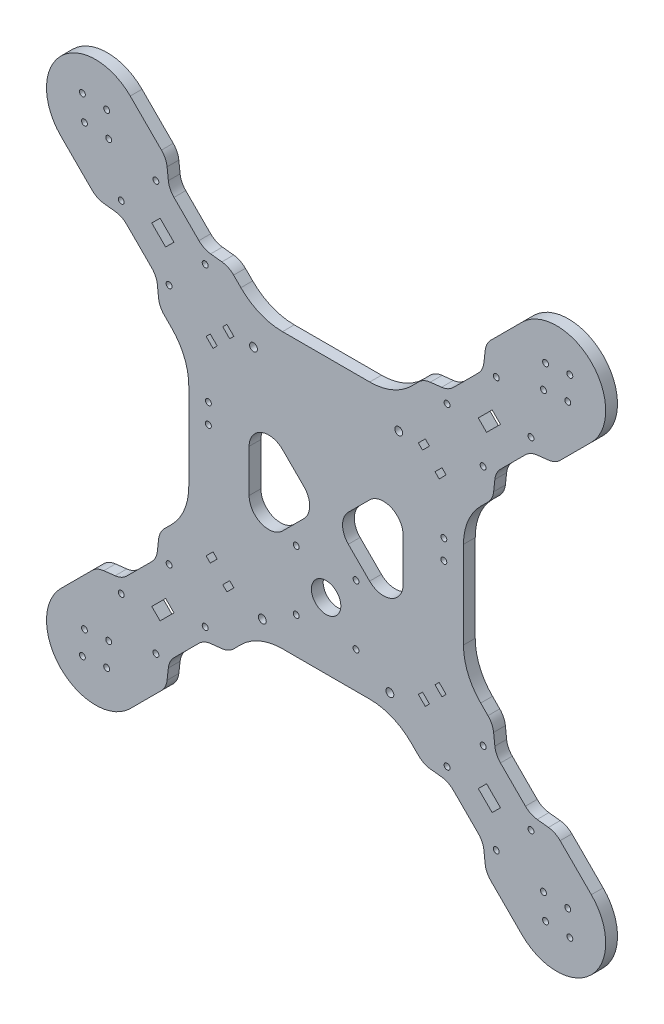
from build123d import *

# Parameters (mm, degrees)
BOSS_EXTRUDE1_DEPTH      = 6
FILLET1_R                = 30
SKETCH8_R                = 1.5
CUT_EXTRUDE1_DEPTH       = 202.614731605
SKETCH9_R                = 1.5
CUT_EXTRUDE2_DEPTH       = 202.614731605
MIRROR2_COPY_1_SKETCH_R  = 1.5
MIRROR2_COPY_1_DEPTH     = 202.614731605
MIRROR2_COPY_2_SKETCH_R  = 1.5
MIRROR2_COPY_2_DEPTH     = 202.614731605
MIRROR2_COPY_3_SKETCH_R  = 1.5
MIRROR2_COPY_3_DEPTH     = 202.614731605
MIRROR2_COPY_4_SKETCH_R  = 1.5
MIRROR2_COPY_4_DEPTH     = 202.614731605
CUT_EXTRUDE3_DEPTH       = 202.614731605
CUT_EXTRUDE3_DEPTH_BACK  = 202.614731605
SKETCH10_R               = 1.5
SKETCH10_R_2             = 1.499999999
SKETCH10_R_3             = 7.5
SKETCH10_R_4             = 2
FILLET2_R                = 10
CUT_EXTRUDE4_DEPTH       = 202.614731605
CIRPATTERN2_COUNT        = 4
CIRPATTERN2_COPY_1_DEPTH = 202.614731605
CIRPATTERN2_COPY_2_DEPTH = 202.614731605
CIRPATTERN2_COPY_3_DEPTH = 202.614731605
FILLET3_R                = 10


with BuildPart() as part:
    # Sketch4 → Boss-Extrude1 (new body)
    with BuildSketch(Plane.XY):
        with BuildLine():
            Line((-70, -34.644660941), (-70, 34.644660941))
            Line((-70, 34.644660941), (-135.17766953, 99.82233047))
            ThreePointArc((-135.17766953, 99.82233047), (-135.17766953, 135.17766953), (-99.82233047, 135.17766953))
            Line((-99.82233047, 135.17766953), (-34.644660941, 70))
            Line((-34.644660941, 70), (34.644660941, 70))
            Line((34.644660941, 70), (99.82233047, 135.17766953))
            ThreePointArc((99.82233047, 135.17766953), (135.17766953, 135.17766953), (135.17766953, 99.82233047))
            Line((135.17766953, 99.82233047), (70, 34.644660941))
            Line((70, 34.644660941), (70, -34.644660941))
            Line((70, -34.644660941), (135.17766953, -99.82233047))
            ThreePointArc((135.17766953, -99.82233047), (135.17766953, -135.17766953), (99.82233047, -135.17766953))
            Line((99.82233047, -135.17766953), (34.644660941, -70))
            Line((34.644660941, -70), (-34.644660941, -70))
            Line((-34.644660941, -70), (-99.82233047, -135.17766953))
            ThreePointArc((-99.82233047, -135.17766953), (-135.17766953, -135.17766953), (-135.17766953, -99.82233047))
            Line((-135.17766953, -99.82233047), (-70, -34.644660941))
        make_face()
    extrude(amount=BOSS_EXTRUDE1_DEPTH)

    # Fillet1
    fillet1_edges = [part.edges().sort_by_distance(p)[0] for p in [
        (34.644660941, -70, 3),
        (70, -34.644660941, 3),
        (70, 34.644660941, 3),
        (34.644660941, 70, 3),
        (-34.644660941, 70, 3),
        (-70, 34.644660941, 3),
        (-70, -34.644660941, 3),
        (-34.644660941, -70, 3),
    ]]
    fillet(fillet1_edges, radius=FILLET1_R)

    # Sketch8 → Cut-Extrude1 (cut, symmetric)
    with BuildSketch(Plane.XY.offset(6)):
        with Locations((-104.418524548, 86.740855018)):
            Circle(SKETCH8_R)
        with Locations((-80.023340597, 61.638564286)):
            Circle(SKETCH8_R)
        with Locations((-86.740855018, 104.418524548)):
            Circle(SKETCH8_R)
        with Locations((-61.638564286, 80.023340597)):
            Circle(SKETCH8_R)
        Polygon((-88.862175362, 84.619534675), (-84.619534675, 88.862175362), (-77.548466863, 81.79110755), (-81.79110755, 77.548466863), align=None)
    cut_extrude1 = extrude(amount=CUT_EXTRUDE1_DEPTH, both=True, mode=Mode.SUBTRACT)

    # Sketch9 → Cut-Extrude2 (cut, symmetric)
    with BuildSketch(Plane.XY.offset(6)):
        with Locations((-124.217514421, 124.217514421)):
            Circle(SKETCH9_R)
        with Locations((-110.782485579, 110.782485579)):
            Circle(SKETCH9_R)
        with Locations((-123.156854249, 111.843145751)):
            Circle(SKETCH9_R)
        with Locations((-111.843145751, 123.156854249)):
            Circle(SKETCH9_R)
    cut_extrude2 = extrude(amount=CUT_EXTRUDE2_DEPTH, both=True, mode=Mode.SUBTRACT)

    # Mirror1: Cut-Extrude1, Cut-Extrude2 across plane
    add(cut_extrude1.mirror(Plane(origin=(0, 0, 0), x_dir=(0, 0, 1), z_dir=(1, 0, 0))), mode=Mode.SUBTRACT)
    add(cut_extrude2.mirror(Plane(origin=(0, 0, 0), x_dir=(0, 0, 1), z_dir=(1, 0, 0))), mode=Mode.SUBTRACT)

    # Mirror2 copy 1 sketch → Mirror2 copy 1 (cut, symmetric)
    with BuildSketch(Plane(origin=(0, 0, 6), x_dir=(-1, 0, 0), z_dir=(0, 0, 1))):
        with Locations((-104.418524548, 86.740855018)):
            Circle(MIRROR2_COPY_1_SKETCH_R)
        with Locations((-80.023340597, 61.638564286)):
            Circle(MIRROR2_COPY_1_SKETCH_R)
        with Locations((-86.740855018, 104.418524548)):
            Circle(MIRROR2_COPY_1_SKETCH_R)
        with Locations((-61.638564286, 80.023340597)):
            Circle(MIRROR2_COPY_1_SKETCH_R)
        Polygon((-88.862175362, 84.619534675), (-84.619534675, 88.862175362), (-77.548466863, 81.79110755), (-81.79110755, 77.548466863), align=None)
    extrude(amount=MIRROR2_COPY_1_DEPTH, both=True, mode=Mode.SUBTRACT)

    # Mirror2 copy 2 sketch → Mirror2 copy 2 (cut, symmetric)
    with BuildSketch(Plane(origin=(0, 0, 6), x_dir=(-1, 0, 0), z_dir=(0, 0, 1))):
        with Locations((-124.217514421, 124.217514421)):
            Circle(MIRROR2_COPY_2_SKETCH_R)
        with Locations((-110.782485579, 110.782485579)):
            Circle(MIRROR2_COPY_2_SKETCH_R)
        with Locations((-123.156854249, 111.843145751)):
            Circle(MIRROR2_COPY_2_SKETCH_R)
        with Locations((-111.843145751, 123.156854249)):
            Circle(MIRROR2_COPY_2_SKETCH_R)
    extrude(amount=MIRROR2_COPY_2_DEPTH, both=True, mode=Mode.SUBTRACT)

    # Mirror2 copy 3 sketch → Mirror2 copy 3 (cut, symmetric)
    with BuildSketch(Plane.XY.offset(6)):
        with Locations((-104.418524548, -86.740855018)):
            Circle(MIRROR2_COPY_3_SKETCH_R)
        with Locations((-80.023340597, -61.638564286)):
            Circle(MIRROR2_COPY_3_SKETCH_R)
        with Locations((-86.740855018, -104.418524548)):
            Circle(MIRROR2_COPY_3_SKETCH_R)
        with Locations((-61.638564286, -80.023340597)):
            Circle(MIRROR2_COPY_3_SKETCH_R)
        Polygon((-88.862175362, -84.619534675), (-84.619534675, -88.862175362), (-77.548466863, -81.79110755), (-81.79110755, -77.548466863), align=None)
    extrude(amount=MIRROR2_COPY_3_DEPTH, both=True, mode=Mode.SUBTRACT)

    # Mirror2 copy 4 sketch → Mirror2 copy 4 (cut, symmetric)
    with BuildSketch(Plane.XY.offset(6)):
        with Locations((-124.217514421, -124.217514421)):
            Circle(MIRROR2_COPY_4_SKETCH_R)
        with Locations((-110.782485579, -110.782485579)):
            Circle(MIRROR2_COPY_4_SKETCH_R)
        with Locations((-123.156854249, -111.843145751)):
            Circle(MIRROR2_COPY_4_SKETCH_R)
        with Locations((-111.843145751, -123.156854249)):
            Circle(MIRROR2_COPY_4_SKETCH_R)
    extrude(amount=MIRROR2_COPY_4_DEPTH, both=True, mode=Mode.SUBTRACT)

    # Sketch10 → Cut-Extrude3 (cut, two sides: drawn at the far end of the back side and taken through both)
    with BuildSketch(Plane.XY.offset(6).offset(-CUT_EXTRUDE3_DEPTH_BACK)):
        with Locations((-60, 20)):
            Circle(SKETCH10_R)
        with Locations((-60, 10)):
            Circle(SKETCH10_R)
        with Locations((60, 20)):
            Circle(SKETCH10_R)
        with Locations((60, 10)):
            Circle(SKETCH10_R)
        with Locations((-15.249999999, -21)):
            Circle(SKETCH10_R_2)
        with Locations((15.249999999, -21)):
            Circle(SKETCH10_R)
        with Locations((-15.249999999, -51.5)):
            Circle(SKETCH10_R_2)
        with Locations((15.249999999, -51.5)):
            Circle(SKETCH10_R)
        with Locations((0, -36.249999999)):
            Circle(SKETCH10_R_3)
        with Locations((-37, 55.742640687)):
            Circle(SKETCH10_R_4)
        with Locations((37, 55.742640687)):
            Circle(SKETCH10_R_4)
        with Locations((32.5, -62)):
            Circle(SKETCH10_R_4)
        with Locations((-32.5, -62)):
            Circle(SKETCH10_R_4)
        Polygon((-49.142135624, -53.384776311), (-47.02081528, -55.506096654), (-50.556349186, -59.04163056), (-52.67766953, -56.920310217), align=None)
        Polygon((-4.242640687, 0), (-39.242640687, 35), (-39.242640687, -35), align=None)
        Polygon((39.242640687, 35), (39.242640687, -35), (4.242640687, 0), align=None)
        Polygon((-57.627416998, -44.899494937), (-55.506096654, -47.02081528), (-59.04163056, -50.556349186), (-61.162950904, -48.435028843), align=None)
        Polygon((-61.162950904, 48.435028843), (-59.04163056, 50.556349186), (-55.506096654, 47.02081528), (-57.627416998, 44.899494937), align=None)
        Polygon((57.627416998, 44.899494937), (55.506096654, 47.02081528), (59.04163056, 50.556349186), (61.162950904, 48.435028843), align=None)
        Polygon((61.162950904, -48.435028843), (57.627416998, -44.899494937), (55.506096654, -47.02081528), (59.04163056, -50.556349186), align=None)
        Polygon((-52.67766953, 56.920310217), (-50.556349186, 59.04163056), (-47.02081528, 55.506096654), (-49.142135624, 53.384776311), align=None)
        Polygon((52.67766953, -56.920310217), (49.142135624, -53.384776311), (47.02081528, -55.506096654), (50.556349186, -59.04163056), align=None)
        Polygon((49.142135624, 53.384776311), (47.02081528, 55.506096654), (50.556349186, 59.04163056), (52.67766953, 56.920310217), align=None)
    extrude(amount=CUT_EXTRUDE3_DEPTH + CUT_EXTRUDE3_DEPTH_BACK, mode=Mode.SUBTRACT)

    # Fillet2
    fillet2_edges = [part.edges().sort_by_distance(p)[0] for p in [
        (4.242640687, 0, 3),
        (39.242640687, -35, 3),
        (39.242640687, 35, 3),
        (-39.242640687, -35, 3),
        (-39.242640687, 35, 3),
        (-4.242640687, 0, 3),
    ]]
    fillet(fillet2_edges, radius=FILLET2_R)

    # Sketch11 → Cut-Extrude4 (cut, symmetric)
    with BuildSketch(Plane.XY.offset(6)):
        Polygon((-80.023340597, 104.064971157), (-62.345671067, 86.387301628), (-49.617749006, 84.973088065), (-81.437554159, 116.792893219), align=None)
    cut_extrude4 = extrude(amount=CUT_EXTRUDE4_DEPTH, both=True, mode=Mode.SUBTRACT)

    # Mirror4: Cut-Extrude4 across plane
    add(cut_extrude4.mirror(Plane(origin=(0, 0, 0), x_dir=(0, 0, 1), z_dir=(0.7071067811865474, 0.7071067811865477, 0))), mode=Mode.SUBTRACT)

    # CirPattern2: Cut-Extrude4 ×4 about axis
    cirpattern2_axis = Axis((0, 0, 0), (0, 0, 1))
    for i in range(1, CIRPATTERN2_COUNT):
        add(cut_extrude4.rotate(cirpattern2_axis, i * 360 / CIRPATTERN2_COUNT), mode=Mode.SUBTRACT)

    # CirPattern2 copy 1 sketch → CirPattern2 copy 1 (cut, symmetric)
    with BuildSketch(Plane.XY.offset(6)):
        Polygon((-80.023340597, -104.064971157), (-62.345671067, -86.387301628), (-49.617749006, -84.973088065), (-81.437554159, -116.792893219), align=None)
    extrude(amount=CIRPATTERN2_COPY_1_DEPTH, both=True, mode=Mode.SUBTRACT)

    # CirPattern2 copy 2 sketch → CirPattern2 copy 2 (cut, symmetric)
    with BuildSketch(Plane(origin=(0, 0, 6), x_dir=(0, 1, 0), z_dir=(0, 0, 1))):
        Polygon((-80.023340597, -104.064971157), (-62.345671067, -86.387301628), (-49.617749006, -84.973088065), (-81.437554159, -116.792893219), align=None)
    extrude(amount=CIRPATTERN2_COPY_2_DEPTH, both=True, mode=Mode.SUBTRACT)

    # CirPattern2 copy 3 sketch → CirPattern2 copy 3 (cut, symmetric)
    with BuildSketch(Plane(origin=(0, 0, 6), x_dir=(-1, 0, 0), z_dir=(0, 0, 1))):
        Polygon((-80.023340597, -104.064971157), (-62.345671067, -86.387301628), (-49.617749006, -84.973088065), (-81.437554159, -116.792893219), align=None)
    extrude(amount=CIRPATTERN2_COPY_3_DEPTH, both=True, mode=Mode.SUBTRACT)

    # Fillet3
    fillet3_edges = [part.edges().sort_by_distance(p)[0] for p in [
        (-49.617749006, 84.973088065, 3),
        (-62.345671067, 86.387301628, 3),
        (-80.023340597, 104.064971157, 3),
        (-81.437554159, 116.792893219, 3),
        (116.792893219, 81.437554159, 3),
        (104.064971157, 80.023340597, 3),
        (86.387301628, 62.345671067, 3),
        (84.973088065, 49.617749006, 3),
        (80.023340597, 104.064971157, 3),
        (81.437554159, 116.792893219, 3),
        (62.345671067, 86.387301628, 3),
        (49.617749006, 84.973088065, 3),
        (116.792893219, -81.437554159, 3),
        (104.064971157, -80.023340597, 3),
        (86.387301628, -62.345671067, 3),
        (84.973088065, -49.617749006, 3),
        (81.437554159, -116.792893219, 3),
        (80.023340597, -104.064971157, 3),
        (62.345671067, -86.387301628, 3),
        (49.617749006, -84.973088065, 3),
        (-49.617749006, -84.973088065, 3),
        (-62.345671067, -86.387301628, 3),
        (-80.023340597, -104.064971157, 3),
        (-81.437554159, -116.792893219, 3),
        (-116.792893219, -81.437554159, 3),
        (-104.064971157, -80.023340597, 3),
        (-86.387301628, -62.345671067, 3),
        (-84.973088065, -49.617749006, 3),
        (-84.973088065, 49.617749006, 3),
        (-86.387301628, 62.345671067, 3),
        (-104.064971157, 80.023340597, 3),
        (-116.792893219, 81.437554159, 3),
    ]]
    fillet(fillet3_edges, radius=FILLET3_R)


solid = part.part
